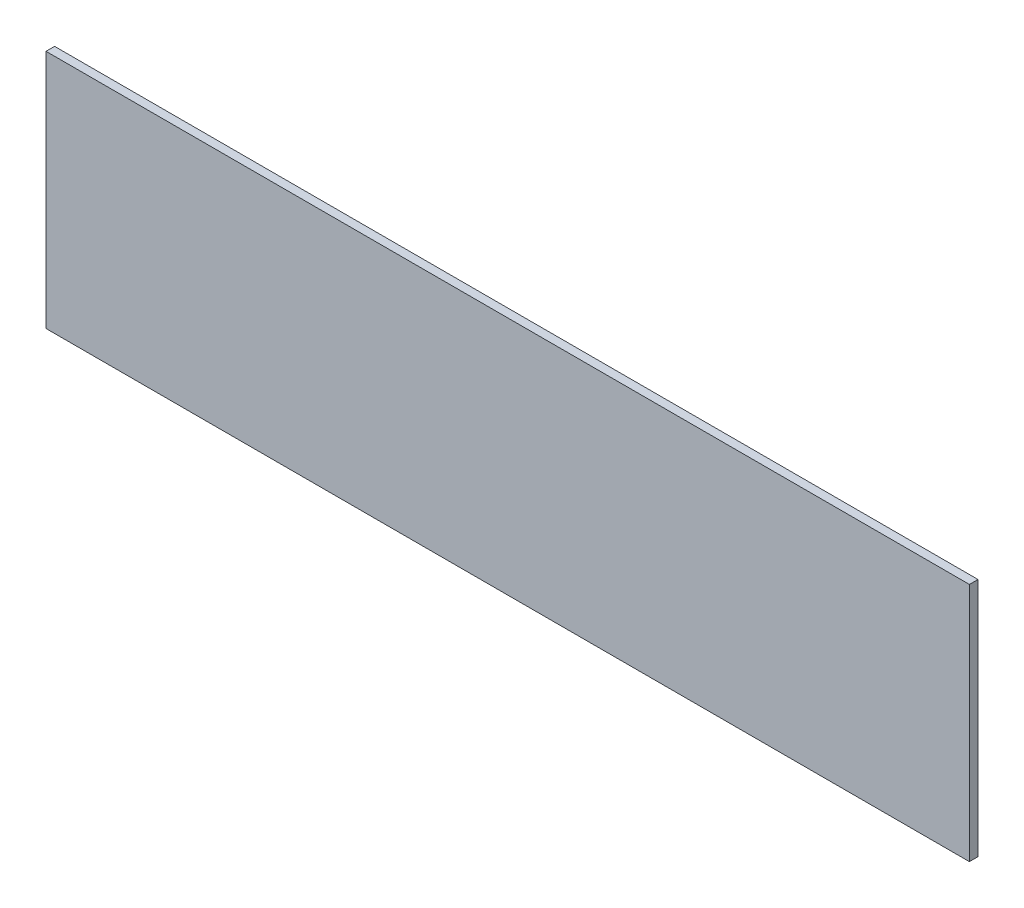
from build123d import *

# Parameters (mm, degrees)
SKETCH2_W           = 254
SKETCH2_H           = 66.04
BOSS_EXTRUDE1_DEPTH = 2.3622


with BuildPart() as part:
    # Sketch2 → Boss-Extrude1 (new body)
    with BuildSketch(Plane.XY):
        with Locations((-127, 33.02)):
            Rectangle(SKETCH2_W, SKETCH2_H)
    extrude(amount=BOSS_EXTRUDE1_DEPTH)


solid = part.part
